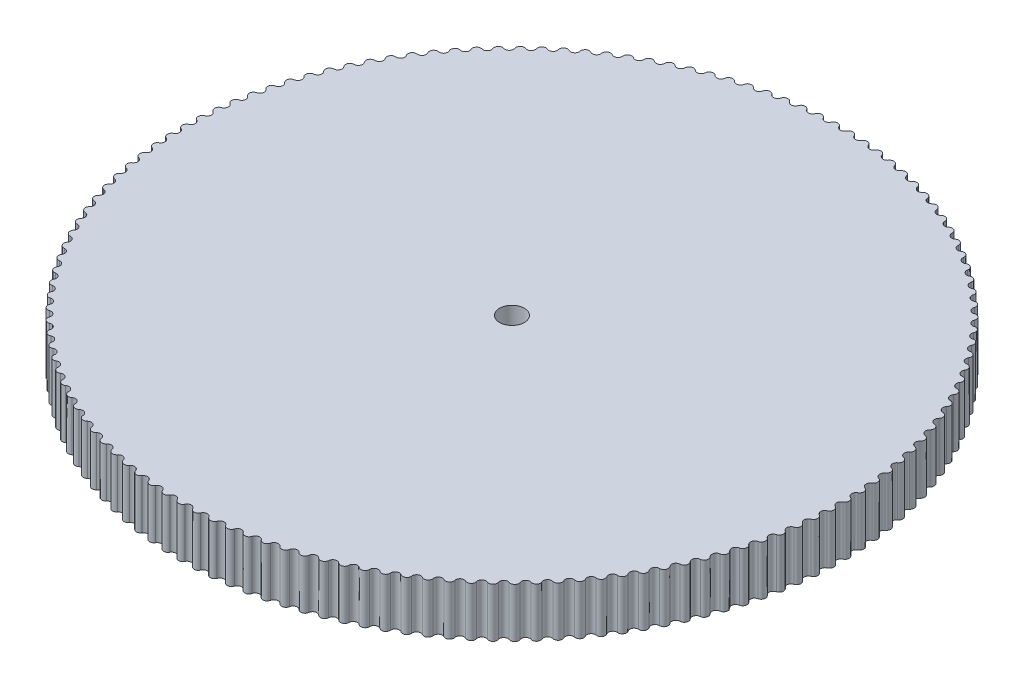
from build123d import *

# Parameters (mm, degrees)
BOSS_EXTRUDE1_DEPTH = 5
CIRPATTERN1_COUNT   = 133


with BuildPart() as part:
    # Sketch1 → Boss-Extrude1 (new body)
    with BuildSketch(Plane(origin=(0, 0, 0), x_dir=(1, 0, 0), z_dir=(0, 1, 0))):
        with BuildLine():
            Line((0, 33), (0, 1.25))
            ThreePointArc((0, 1.25), (0.029523501, 1.249651297), (0.05903053, 1.248605381))
            Line((0.05903053, 1.248605381), (1.558406, 32.963182048))
            ThreePointArc((1.558406, 32.963182048), (1.177850765, 33.229131309), (0.77942043, 32.990794228))
            ThreePointArc((0.77942043, 32.990794228), (0.38678484, 32.747715913), (0, 33))
        make_face()
    boss_extrude1 = extrude(amount=BOSS_EXTRUDE1_DEPTH)

    # CirPattern1: Boss-Extrude1 ×133 about axis
    cirpattern1_axis = Axis((0, 0, 0), (0, 1, 0))
    for i in range(1, CIRPATTERN1_COUNT):
        add(boss_extrude1.rotate(cirpattern1_axis, i * 360 / CIRPATTERN1_COUNT))


solid = part.part
